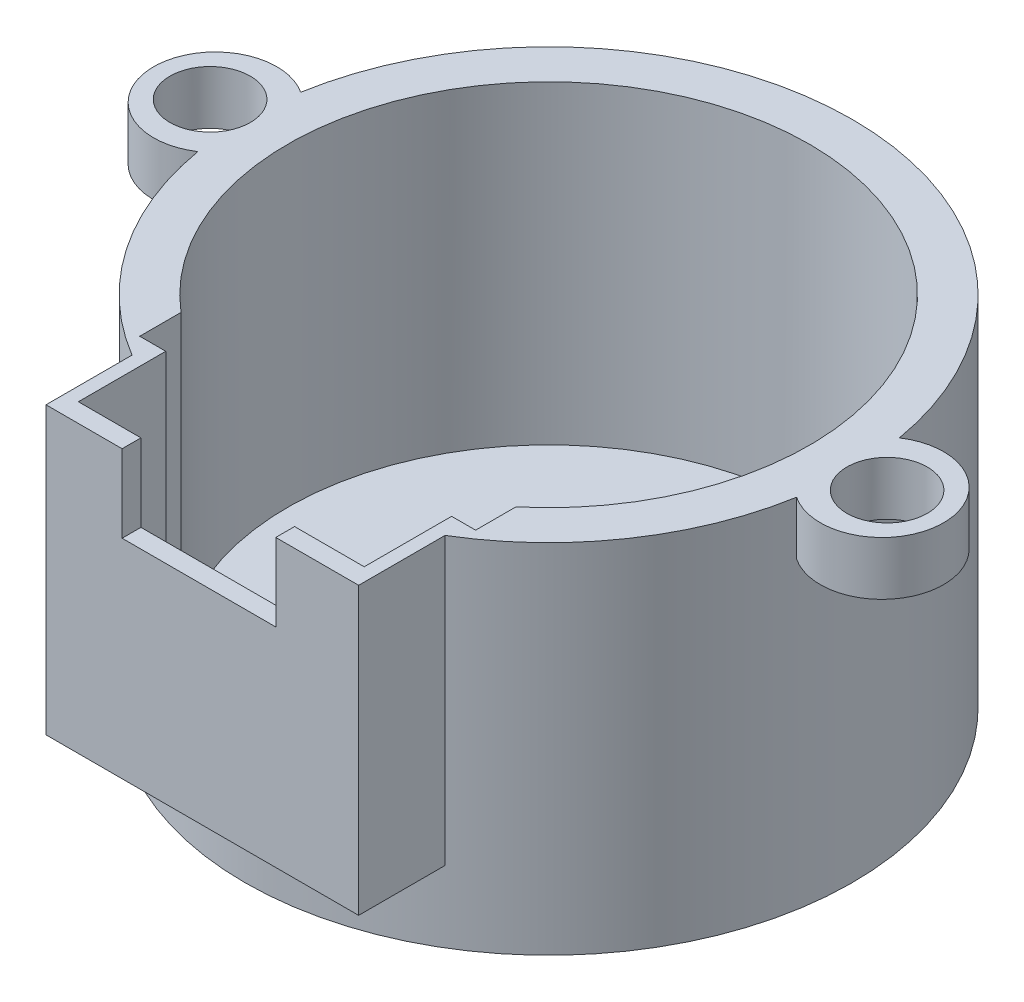
from build123d import *

# Parameters (mm, degrees)
SKETCH1_R           = 17
BOSS_EXTRUDE1_DEPTH = 20
SHELL1_T            = -2.4
SKETCH2_R           = 3.45
BOSS_EXTRUDE3_DEPTH = 3
SKETCH4_R           = 2.25
CUT_EXTRUDE1_DEPTH  = 3
SKETCH5_W           = 17.5
SKETCH5_H           = 7.7
BOSS_EXTRUDE4_DEPTH = 16
SKETCH6_W           = 16
SKETCH6_H           = 8.6
CUT_EXTRUDE2_DEPTH  = 14
SKETCH7_W           = 8.6
SKETCH7_H           = 5.8
CUT_EXTRUDE3_DEPTH  = 5
FILLET4_R           = 1
SKETCH8_W           = 18.8
SKETCH8_H           = 3
CUT_EXTRUDE4_DEPTH  = 16


with BuildPart() as part:
    # Sketch1 → Boss-Extrude1 (new body)
    with BuildSketch(Plane(origin=(0, 0, 0), x_dir=(1, 0, 0), z_dir=(0, 1, 0))):
        Circle(SKETCH1_R)
    extrude(amount=BOSS_EXTRUDE1_DEPTH)

    # Shell1
    shell1_openings = [part.faces().sort_by_distance(p)[0] for p in [
        (0, 20, 0),
    ]]
    offset(amount=SHELL1_T, openings=shell1_openings, kind=Kind.INTERSECTION)

    # Sketch2 → Boss-Extrude3 (add)
    with BuildSketch(Plane(origin=(0, 20, 0), x_dir=(1, 0, 0), z_dir=(0, 1, 0))):
        with Locations((18.659372003, 0)):
            Circle(SKETCH2_R)
        with Locations((-18.659372003, 0)):
            Circle(SKETCH2_R)
    extrude(amount=-BOSS_EXTRUDE3_DEPTH)

    # Sketch4 → Cut-Extrude1 (cut)
    with BuildSketch(Plane(origin=(0, 20, 0), x_dir=(1, 0, 0), z_dir=(0, 1, 0))):
        with Locations((18.946509427, 0)):
            Circle(SKETCH4_R)
        with Locations((-18.946509427, 0)):
            Circle(SKETCH4_R)
    extrude(amount=-CUT_EXTRUDE1_DEPTH, mode=Mode.SUBTRACT)

    # Sketch5 → Boss-Extrude4 (add)
    with BuildSketch(Plane(origin=(0, 20, 0), x_dir=(1, 0, 0), z_dir=(0, 1, 0))):
        with Locations((0.01757968, -15.550633972)):
            Rectangle(SKETCH5_W, SKETCH5_H)
    extrude(amount=-BOSS_EXTRUDE4_DEPTH)

    # Sketch6 → Cut-Extrude2 (cut)
    with BuildSketch(Plane(origin=(0, 20, 0), x_dir=(1, 0, 0), z_dir=(0, 1, 0))):
        with Locations((0.025977535, -14.047647825)):
            Rectangle(SKETCH6_W, SKETCH6_H)
    extrude(amount=-CUT_EXTRUDE2_DEPTH, mode=Mode.SUBTRACT)

    # Sketch7 → Cut-Extrude3 (cut)
    with BuildSketch(Plane.XY.offset(19.400633972)):
        with Locations((-0.172487463, 18.560997168)):
            Rectangle(SKETCH7_W, SKETCH7_H)
    extrude(amount=-CUT_EXTRUDE3_DEPTH, mode=Mode.SUBTRACT)

    # Fillet4
    fillet4_edges = [part.edges().sort_by_distance(p)[0] for p in [
        (0, 4, 11.700633972),
    ]]
    fillet(fillet4_edges, radius=FILLET4_R)

    # Sketch8 → Cut-Extrude4 (cut)
    with BuildSketch(Plane(origin=(0, 20, 0), x_dir=(1, 0, 0), z_dir=(0, 1, 0))):
        with Locations((-0.031709419, -11.955798022)):
            Rectangle(SKETCH8_W, SKETCH8_H)
    extrude(amount=-CUT_EXTRUDE4_DEPTH, mode=Mode.SUBTRACT)


solid = part.part
